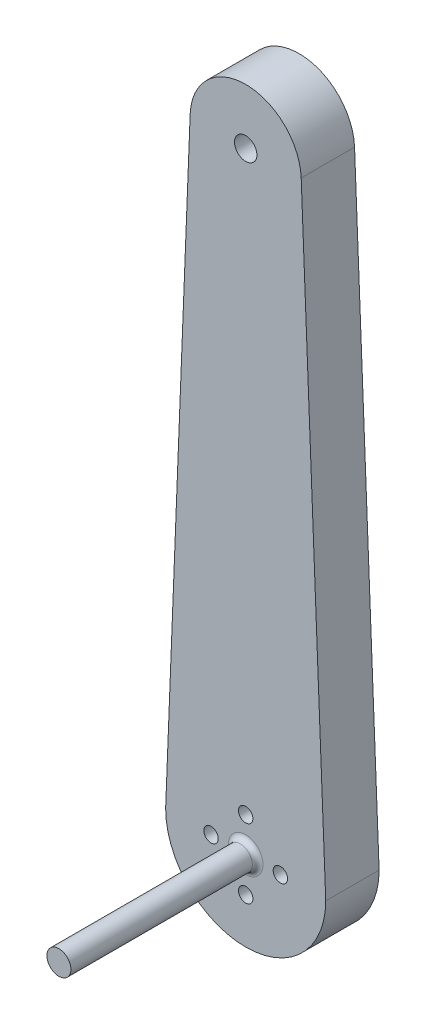
from build123d import *

# Parameters (mm, degrees)
SKETCH_1_W          = 30
SKETCH_1_H          = 140
EXTRUDE_1_DEPTH     = 10
FILLET_1_RADIUS     = 15
FILLET_1_LENGTH     = 10
CUT_EXTRUDE_1_DEPTH = 10
FILLET_2_R          = 10.407997
SKETCH_3_R          = 2.1
CUT_EXTRUDE_2_DEPTH = 144.527000944
SKETCH_4_R          = 1.35
CUT_EXTRUDE_3_DEPTH = 144.527000944
SKETCH_5_R          = 2.25
EXTRUDE_2_DEPTH     = 35
FILLET_3_R          = 1


with BuildPart() as part:
    # 草图1 → 凸台-拉伸1 (new body)
    with BuildSketch(Plane.XY):
        with Locations((15, 70)):
            Rectangle(SKETCH_1_W, SKETCH_1_H)
    extrude(amount=EXTRUDE_1_DEPTH)

    # 圆角1: full round fillet: the end face becomes a half cylinder, R = half its width
    fillet_1_face = Plane((15, 0, 5), x_dir=(0, 0, 1), z_dir=(0, -1, 0))  # on the end face: x along it, z out of the body
    fillet_1_slab = fillet_1_face.offset(-FILLET_1_RADIUS / 2) * Box(FILLET_1_LENGTH, 2 * FILLET_1_RADIUS, FILLET_1_RADIUS, mode=Mode.PRIVATE)  # the body's end, R deep
    fillet_1_round = Plane((15, 15, 5), x_dir=(0, -1, 0), z_dir=(0, 0, 1)) * Cylinder(FILLET_1_RADIUS, FILLET_1_LENGTH, mode=Mode.PRIVATE)  # its axis R under the face
    add(fillet_1_slab - fillet_1_round, mode=Mode.SUBTRACT)

    # 草图2 → 切除-拉伸1 (cut)
    with BuildSketch(Plane.XY.offset(10)):
        Polygon((0, 15), (5, 140), (0, 140), align=None)
        Polygon((30, 15), (25, 140), (30, 140), align=None)
    extrude(amount=-CUT_EXTRUDE_1_DEPTH, mode=Mode.SUBTRACT)

    # 圆角2
    fillet_2_edges = [part.edges().sort_by_distance(p)[0] for p in [
        (5, 140, 5),
        (25, 140, 5),
    ]]
    fillet(fillet_2_edges, radius=FILLET_2_R - 0.0001)  # a hair under: the kernel refuses the full size

    # 草图3 → 切除-拉伸2 (cut, through all)
    with BuildSketch(Plane.XY.offset(10)):
        with Locations((15, 129.592003197)):
            Circle(SKETCH_3_R)
    extrude(amount=-CUT_EXTRUDE_2_DEPTH, mode=Mode.SUBTRACT)

    # 草图4 → 切除-拉伸3 (cut, through all)
    with BuildSketch(Plane.XY.offset(10)):
        with Locations((15, 8.5)):
            Circle(SKETCH_4_R)
        with Locations((21.5, 15)):
            Circle(SKETCH_4_R)
        with Locations((15, 21.5)):
            Circle(SKETCH_4_R)
        with Locations((8.5, 15)):
            Circle(SKETCH_4_R)
    extrude(amount=-CUT_EXTRUDE_3_DEPTH, mode=Mode.SUBTRACT)

    # 草图5 → 凸台-拉伸2 (add)
    with BuildSketch(Plane.XY.offset(10)):
        with Locations(Location((15, 15, 0), (0, 0, 180))):
            Circle(SKETCH_5_R)
    extrude(amount=EXTRUDE_2_DEPTH)

    # 圆角3
    fillet_3_edges = [part.edges().sort_by_distance(p)[0] for p in [
        (17.25, 15, 10),
    ]]
    fillet(fillet_3_edges, radius=FILLET_3_R)


solid = part.part
